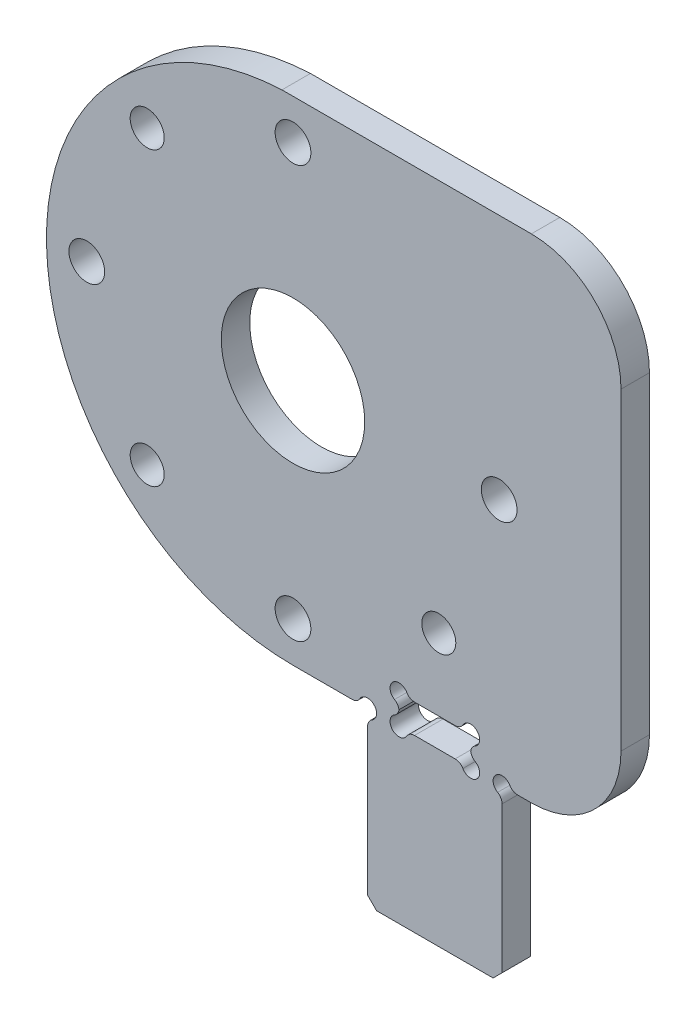
from build123d import *

# Parameters (mm, degrees)
SKETCH1_R           = 8
SKETCH1_R_2         = 1.89865
SKETCH1_R_3         = 1.9939
BOSS_EXTRUDE1_DEPTH = 3.175
FILLET1_R           = 10
SKETCH2_W           = 15
SKETCH2_H           = 19.05
BOSS_EXTRUDE2_DEPTH = 3.175
SKETCH3_R           = 1
CUT_EXTRUDE1_DEPTH  = 158.949594679
CHAMFER1_SIZE       = 1
FILLET2_R           = 1
SKETCH4_W           = 7.99338
SKETCH4_H           = 3.22072
CUT_EXTRUDE2_DEPTH  = 158.949594679
CUT_EXTRUDE3_DEPTH  = 158.949594679
FILLET3_R           = 10
SKETCH6_R           = 1
CUT_EXTRUDE4_DEPTH  = 124.748935267
FILLET4_R           = 1


with BuildPart() as part:
    # Sketch1 → Boss-Extrude1 (new body)
    with BuildSketch(Plane.XY):
        with BuildLine():
            Line((-40.498784978, 0), (0, 0))
            Line((0, 0), (0, 75))
            ThreePointArc((0, 75), (-37.5, 112.5), (-75, 75))
            Line((-75, 75), (-75, 55))
            Line((-75, 55), (-83.323029145, 55))
            ThreePointArc((-83.323029145, 55), (-110.823029145, 27.5), (-83.323029145, 0))
            Line((-83.323029145, 0), (-40.498784978, 0))
        make_face()
        with Locations((-83.323029145, 27.5)):
            Circle(SKETCH1_R, mode=Mode.SUBTRACT)
        with Locations((-67.059573177, 11.236544033)):
            Circle(SKETCH1_R_2, mode=Mode.SUBTRACT)
        with Locations((-83.323029145, 50.5)):
            Circle(SKETCH1_R_3, mode=Mode.SUBTRACT)
        with Locations((-99.586485112, 11.236544033)):
            Circle(SKETCH1_R_2, mode=Mode.SUBTRACT)
        with Locations((-60.323029145, 27.5)):
            Circle(SKETCH1_R_3, mode=Mode.SUBTRACT)
        with Locations((-99.586485112, 43.763455967)):
            Circle(SKETCH1_R_2, mode=Mode.SUBTRACT)
        with Locations((-83.323029145, 4.5)):
            Circle(SKETCH1_R_3, mode=Mode.SUBTRACT)
        with Locations((-106.323029145, 27.5)):
            Circle(SKETCH1_R_3, mode=Mode.SUBTRACT)
    extrude(amount=BOSS_EXTRUDE1_DEPTH)

    # Fillet1
    fillet1_edges = [part.edges().sort_by_distance(p)[0] for p in [
        (-75, 55, 1.5875),
    ]]
    fillet(fillet1_edges, radius=FILLET1_R)

    # Sketch2 → Boss-Extrude2 (add)
    with BuildSketch(Plane(origin=(0, 0, 0), x_dir=(-1, 0, 0), z_dir=(0, 0, -1))):
        with Locations((7.5, -9.525)):
            Rectangle(SKETCH2_W, SKETCH2_H)
        with Locations((37.5, -9.525)):
            Rectangle(SKETCH2_W, SKETCH2_H)
        with Locations((67.5, -9.525)):
            Rectangle(SKETCH2_W, SKETCH2_H)
    extrude(amount=-BOSS_EXTRUDE2_DEPTH)

    # Sketch3 → Cut-Extrude1 (cut, through all)
    with BuildSketch(Plane.XY.offset(3.175)):
        with Locations((-75, 0)):
            Circle(SKETCH3_R)
        with Locations((-60, 0)):
            Circle(SKETCH3_R)
        with Locations((-45, 0)):
            Circle(SKETCH3_R)
        with Locations((-30, 0)):
            Circle(SKETCH3_R)
        with Locations((-15, 0)):
            Circle(SKETCH3_R)
    extrude(amount=-CUT_EXTRUDE1_DEPTH, mode=Mode.SUBTRACT)

    # Chamfer1
    chamfer1_edges = [part.edges().sort_by_distance(p)[0] for p in [
        (0, -19.05, 1.5875),
        (-15, -19.05, 1.5875),
        (-30, -19.05, 1.5875),
        (-45, -19.05, 1.5875),
        (-60, -19.05, 1.5875),
        (-75, -19.05, 1.5875),
    ]]
    chamfer(chamfer1_edges, length=CHAMFER1_SIZE)

    # Fillet2
    fillet2_edges = [part.edges().sort_by_distance(p)[0] for p in [
        (-75, -1, 1.5875),
        (-76, 0, 1.5875),
        (-60, -1, 1.5875),
        (-59, 0, 1.5875),
        (-45, -1, 1.5875),
        (-46, 0, 1.5875),
        (-30, -1, 1.5875),
        (-29, 0, 1.5875),
        (-15, -1, 1.5875),
        (-16, 0, 1.5875),
    ]]
    fillet(fillet2_edges, radius=FILLET2_R)

    # Sketch4 → Cut-Extrude2 (cut, through all)
    with BuildSketch(Plane.XY.offset(3.175)):
        with Locations((-67.5, 1.61036)):
            Rectangle(SKETCH4_W, SKETCH4_H)
    extrude(amount=-CUT_EXTRUDE2_DEPTH, mode=Mode.SUBTRACT)

    # Sketch5 → Cut-Extrude3 (cut, through all)
    with BuildSketch(Plane(origin=(0, 0, 0), x_dir=(-1, 0, 0), z_dir=(0, 0, -1))):
        Polygon((84.552807772, 54.972488867), (46.732050808, 54.972488867), (46.732050808, 0), (46.732050808, -19.05), (0, -19.05), (0, 112.5), (84.552807772, 112.5), align=None)
    extrude(amount=-CUT_EXTRUDE3_DEPTH, mode=Mode.SUBTRACT)

    # Fillet3
    fillet3_edges = [part.edges().sort_by_distance(p)[0] for p in [
        (-46.732050808, 0, 1.5875),
        (-46.732050808, 54.972488867, 1.5875),
    ]]
    fillet(fillet3_edges, radius=FILLET3_R)

    # Sketch6 → Cut-Extrude4 (cut, through all)
    with BuildSketch(Plane(origin=(0, 0, 0), x_dir=(-1, 0, 0), z_dir=(0, 0, -1))):
        with Locations((63.50331, 3.22072)):
            Circle(SKETCH6_R)
        with Locations((71.49669, 3.22072)):
            Circle(SKETCH6_R)
        with Locations((71.49669, 0)):
            Circle(SKETCH6_R)
        with Locations((63.50331, 0)):
            Circle(SKETCH6_R)
    extrude(amount=-CUT_EXTRUDE4_DEPTH, mode=Mode.SUBTRACT)

    # Fillet4
    # the kernel refuses this fillet: 1 mm, written as the material it takes off along each edge
    with BuildSketch(Plane(origin=(-70.49669, 3.22072, 5.005127019), x_dir=(1, 0, 0), z_dir=(0, 0, -1)), Plane(origin=(-71.49669, 1, 5.005127019), x_dir=(0, 1, 0), z_dir=(0, 0, -1)), Plane(origin=(-63.50331, 2.22072, 5.005127019), x_dir=(0, -1, 0), z_dir=(0, 0, -1))) as fillet4_piece_1:
        with BuildLine():
            CenterArc((0.732050808, -1), FILLET4_R, 90, 60)
            ThreePointArc((-0.133974596, -0.5), (-0.034074174, -0.258819045), (0, 0))
            Line((0, 0), (0.732050808, 0))
        make_face()
    extrude(amount=6.835254038, mode=Mode.SUBTRACT)
    with BuildSketch(Plane(origin=(-71.49669, 2.22072, 5.005127019), x_dir=(-0.9659258262890673, 0.25881904510252446, 0), z_dir=(0, 0, -1)), Plane(origin=(-70.49669, 0, 5.005127019), x_dir=(-0.25881904510253056, -0.9659258262890658, 0), z_dir=(0, 0, -1))) as fillet4_piece_2:
        with BuildLine():
            CenterArc((0.776457135, -0.965925826), FILLET4_R, 105, 60)
            Line((-0.189468691, -0.707106781), (0, 0))
            ThreePointArc((0, 0), (0.258819045, -0.034074174), (0.51763809, 0))
        make_face()
    extrude(amount=6.835254038, mode=Mode.SUBTRACT)
    with BuildSketch(Plane(origin=(-64.50331, 0, -1.830127019), x_dir=(-1, 0, 0), z_dir=(0, 0, 1)), Plane(origin=(-63.50331, 1, 5.005127019), x_dir=(0, 1, 0), z_dir=(0, 0, -1))) as fillet4_piece_3:
        with BuildLine():
            CenterArc((0.732050808, 1), FILLET4_R, 210, 60)
            ThreePointArc((-0.133974596, 0.5), (-0.034074174, 0.258819045), (0, 0))
            Line((0, 0), (0.732050808, 0))
        make_face()
    extrude(amount=6.835254038, mode=Mode.SUBTRACT)
    with BuildSketch(Plane(origin=(-64.50331, 3.22072, -1.830127019), x_dir=(0.25881904510250514, 0.9659258262890725, 0), z_dir=(0, 0, 1))) as fillet4_piece_4:
        with BuildLine():
            CenterArc((0.776457135, 0.965925826), FILLET4_R, 195, 60)
            Line((-0.189468691, 0.707106781), (0, 0))
            ThreePointArc((0, 0), (0.258819045, 0.034074174), (0.51763809, 0))
        make_face()
    extrude(amount=6.835254038, mode=Mode.SUBTRACT)


solid = part.part
